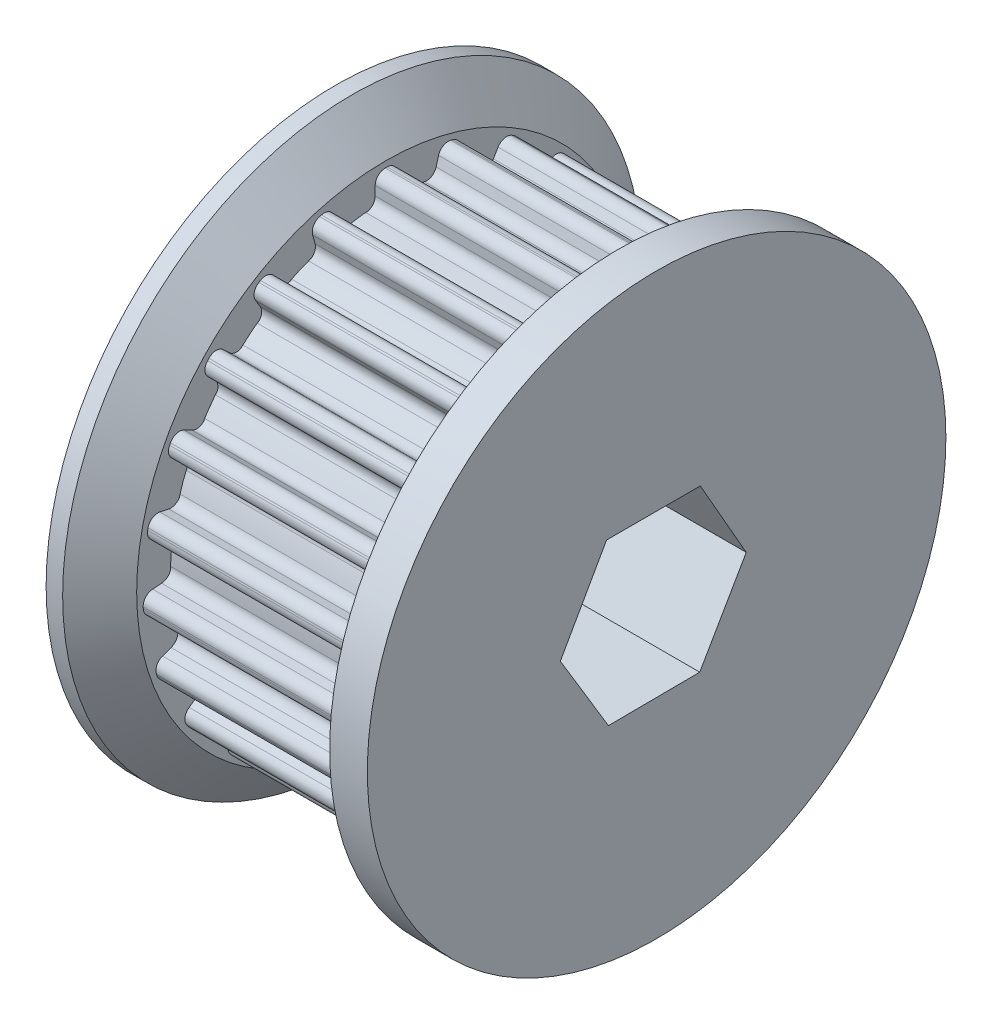
from build123d import *

# Parameters (mm, degrees)
SKETCH1_R               = 17.116
BOSS_EXTRUDE1_DEPTH     = 18.54
BOSS_EXTRUDE6_DEPTH     = 18.5
FILLET6_R               = 0.8
CIRPATTERN6_START       = 0.04
CIRPATTERN6_DEPTH       = 18.5
SKETCH10_R              = 23
BOSS_EXTRUDE7_DEPTH     = 3
BOSS_EXTRUDE8_START     = 4
SKETCH11_R              = 23
BOSS_EXTRUDE8_DEPTH     = 4
CHAMFER1_SIZE           = 3.2
CHAMFER1_SIZE2          = 2.68511882
CUT_EXTRUDE5_DEPTH      = 40.012454422
CUT_EXTRUDE5_DEPTH_BACK = 40.012454422


# Read off the part's stored shape, not the designer's step: CirPattern6
with BuildPart() as part:
    # Sketch1 → Boss-Extrude1 (new body)
    with BuildSketch(Plane(origin=(0, 0, 0), x_dir=(0, 0, -1), z_dir=(1, 0, 0))):
        Circle(SKETCH1_R)
    extrude(amount=BOSS_EXTRUDE1_DEPTH)

    # Sketch8 → Boss-Extrude6 (add)
    with BuildSketch(Plane(origin=(18.54, 0, 0), x_dir=(0, 0, -1), z_dir=(1, 0, 0))):
        Polygon((0, 19.36), (0.875, 19.36), (0.875, 17), (-0.875, 17), (-0.875, 19.36), align=None)
    extrude(amount=-BOSS_EXTRUDE6_DEPTH)

    # Fillet6
    fillet6_edges = [part.edges().sort_by_distance(p)[0] for p in [
        (9.29, 19.36, 0.875),
        (9.29, 17.093619599, -0.875),
        (9.29, 17.093619599, 0.875),
        (9.29, 19.36, -0.875),
    ]]
    fillet(fillet6_edges, radius=FILLET6_R)

    # CirPattern6 outline → CirPattern6 (add)
    with BuildSketch(Plane.YZ.offset(CIRPATTERN6_START)):
        with BuildLine():
            ThreePointArc((15.977374418, -6.138482117), (16.365129587, -5.710481094), (16.939992598, -5.655060282))
            Line((16.939992598, -5.655060282), (17.635672678, -5.849980699))
            ThreePointArc((17.635672678, -5.849980699), (18.243598269, -5.776975245), (18.621843925, -5.295484286))
            Line((18.621843925, -5.295484286), (18.662313441, -5.151046693))
            ThreePointArc((18.662313441, -5.151046693), (18.589307987, -4.543121102), (18.107817028, -4.164875446))
            Line((18.107817028, -4.164875446), (17.412136947, -3.969955029))
            ThreePointArc((17.412136947, -3.969955029), (16.9497586, -3.623912818), (16.840835522, -3.056749076))
            ThreePointArc((16.840835522, -3.056749076), (16.48129229, -4.617841535), (15.977374418, -6.138482117))
        make_face()
        with BuildLine():
            ThreePointArc((15.695366628, -8.520476655), (15.343495596, -8.062518443), (15.391630627, -7.486999576))
            ThreePointArc((15.391630627, -7.486999576), (14.624242528, -8.893198889), (13.728747379, -10.221494578))
            ThreePointArc((13.728747379, -10.221494578), (14.217596828, -9.913980086), (14.786094715, -10.015710613))
            Line((14.786094715, -10.015710613), (15.403388192, -10.391095092))
            ThreePointArc((15.403388192, -10.391095092), (16.008466889, -10.48481324), (16.502590876, -10.123226728))
            Line((16.502590876, -10.123226728), (16.580528468, -9.995063817))
            ThreePointArc((16.580528468, -9.995063817), (16.674246616, -9.389985121), (16.312660105, -8.895861134))
            Line((16.312660105, -8.895861134), (15.695366628, -8.520476655))
        make_face()
        with BuildLine():
            ThreePointArc((12.814542767, -12.439073505), (12.599275714, -11.903163958), (12.8008989, -11.361973568))
            ThreePointArc((12.8008989, -11.361973568), (11.682579599, -12.508988365), (10.461921951, -13.546425547))
            ThreePointArc((10.461921951, -13.546425547), (11.015609954, -13.38220453), (11.535579829, -13.633541506))
            Line((11.535579829, -13.633541506), (12.028704869, -14.161549497))
            ThreePointArc((12.028704869, -14.161549497), (12.586060752, -14.415040601), (13.159416155, -14.200175754))
            Line((13.159416155, -14.200175754), (13.26904155, -14.097792783))
            ThreePointArc((13.26904155, -14.097792783), (13.522532653, -13.5404369), (13.307667807, -12.967081497))
            Line((13.307667807, -12.967081497), (12.814542767, -12.439073505))
        make_face()
        with BuildLine():
            ThreePointArc((15.977374418, 6.138482117), (16.48129229, 4.617841535), (16.840835522, 3.056749076))
            ThreePointArc((16.840835522, 3.056749076), (16.9497586, 3.623912818), (17.412136947, 3.969955029))
            Line((17.412136947, 3.969955029), (18.107817028, 4.164875446))
            ThreePointArc((18.107817028, 4.164875446), (18.589307987, 4.543121102), (18.662313441, 5.151046693))
            Line((18.662313441, 5.151046693), (18.621843925, 5.295484286))
            ThreePointArc((18.621843925, 5.295484286), (18.243598269, 5.776975245), (17.635672678, 5.849980699))
            Line((17.635672678, 5.849980699), (16.939992598, 5.655060282))
            ThreePointArc((16.939992598, 5.655060282), (16.365129587, 5.710481094), (15.977374418, 6.138482117))
        make_face()
        with BuildLine():
            ThreePointArc((8.983322892, -15.435121179), (8.920625191, -14.861006256), (9.260783062, -14.394281958))
            ThreePointArc((9.260783062, -14.394281958), (7.874473186, -15.197043398), (6.419183632, -15.866680103))
            ThreePointArc((6.419183632, -15.866680103), (6.996645682, -15.857932082), (7.42952376, -16.240234995))
            Line((7.42952376, -16.240234995), (7.761907534, -16.881706562))
            ThreePointArc((7.761907534, -16.881706562), (8.230204068, -17.276170345), (8.840267739, -17.223962706))
            Line((8.840267739, -17.223962706), (8.973450522, -17.15495295))
            ThreePointArc((8.973450522, -17.15495295), (9.367914305, -16.686656416), (9.315706666, -16.076592746))
            Line((9.315706666, -16.076592746), (8.983322892, -15.435121179))
        make_face()
        with BuildLine():
            ThreePointArc((13.728747379, 10.221494578), (14.624242528, 8.893198889), (15.391630627, 7.486999576))
            ThreePointArc((15.391630627, 7.486999576), (15.343495596, 8.062518443), (15.695366628, 8.520476655))
            Line((15.695366628, 8.520476655), (16.312660105, 8.895861134))
            ThreePointArc((16.312660105, 8.895861134), (16.674246616, 9.389985121), (16.580528468, 9.995063817))
            Line((16.580528468, 9.995063817), (16.502590876, 10.123226728))
            ThreePointArc((16.502590876, 10.123226728), (16.008466889, 10.48481324), (15.403388192, 10.391095092))
            Line((15.403388192, 10.391095092), (14.786094715, 10.015710613))
            ThreePointArc((14.786094715, 10.015710613), (14.217596828, 9.913980086), (13.728747379, 10.221494578))
        make_face()
        with BuildLine():
            ThreePointArc((4.485851054, -17.286416526), (4.580372706, -16.716675704), (5.033837309, -16.359032305))
            ThreePointArc((5.033837309, -16.359032305), (3.482353119, -16.758003245), (1.900363829, -17.010175582))
            ThreePointArc((1.900363829, -17.010175582), (2.458772208, -17.157549358), (2.7724539, -17.642464549))
            Line((2.7724539, -17.642464549), (2.919445026, -18.349824679))
            ThreePointArc((2.919445026, -18.349824679), (3.263950799, -18.856005568), (3.865477106, -18.970327139))
            Line((3.865477106, -18.970327139), (4.012339719, -18.939808737))
            ThreePointArc((4.012339719, -18.939808737), (4.518520608, -18.595302963), (4.632842179, -17.993776656))
            Line((4.632842179, -17.993776656), (4.485851054, -17.286416526))
        make_face()
        with BuildLine():
            ThreePointArc((10.461921951, 13.546425547), (11.682579599, 12.508988365), (12.8008989, 11.361973568))
            ThreePointArc((12.8008989, 11.361973568), (12.599275714, 11.903163958), (12.814542767, 12.439073505))
            Line((12.814542767, 12.439073505), (13.307667807, 12.967081497))
            ThreePointArc((13.307667807, 12.967081497), (13.522532653, 13.5404369), (13.26904155, 14.097792783))
            Line((13.26904155, 14.097792783), (13.159416155, 14.200175754))
            ThreePointArc((13.159416155, 14.200175754), (12.586060752, 14.415040601), (12.028704869, 14.161549497))
            Line((12.028704869, 14.161549497), (11.535579829, 13.633541506))
            ThreePointArc((11.535579829, 13.633541506), (11.015609954, 13.38220453), (10.461921951, 13.546425547))
        make_face()
        with BuildLine():
            ThreePointArc((-0.344315836, -17.85565744), (-0.099585068, -17.332545789), (0.433554872, -17.110508063))
            ThreePointArc((0.433554872, -17.110508063), (-1.168037147, -17.076098653), (-2.759397265, -16.892104154))
            ThreePointArc((-2.759397265, -16.892104154), (-2.261457153, -17.184669688), (-2.090236182, -17.736233216))
            Line((-2.090236182, -17.736233216), (-2.139539365, -18.457020244))
            ThreePointArc((-2.139539365, -18.457020244), (-1.94437477, -19.037377118), (-1.39599828, -19.309749191))
            Line((-1.39599828, -19.309749191), (-1.246347965, -19.319985553))
            ThreePointArc((-1.246347965, -19.319985553), (-0.665991091, -19.124820957), (-0.393619019, -18.576444468))
            Line((-0.393619019, -18.576444468), (-0.344315836, -17.85565744))
        make_face()
        with BuildLine():
            ThreePointArc((6.419183632, 15.866680103), (7.874473186, 15.197043398), (9.260783062, 14.394281958))
            ThreePointArc((9.260783062, 14.394281958), (8.920625191, 14.861006256), (8.983322892, 15.435121179))
            Line((8.983322892, 15.435121179), (9.315706666, 16.076592746))
            ThreePointArc((9.315706666, 16.076592746), (9.367914305, 16.686656416), (8.973450522, 17.15495295))
            Line((8.973450522, 17.15495295), (8.840267739, 17.223962706))
            ThreePointArc((8.840267739, 17.223962706), (8.230204068, 17.276170345), (7.761907534, 16.881706562))
            Line((7.761907534, 16.881706562), (7.42952376, 16.240234995))
            ThreePointArc((7.42952376, 16.240234995), (6.996645682, 15.857932082), (6.419183632, 15.866680103))
        make_face()
        with BuildLine():
            ThreePointArc((-5.148946395, -17.100625925), (-4.772157074, -16.662940244), (-4.198882347, -16.592975714))
            ThreePointArc((-4.198882347, -16.592975714), (-5.731799442, -16.127737943), (-7.214506488, -15.521222636))
            ThreePointArc((-7.214506488, -15.521222636), (-6.813964582, -15.937281682), (-6.797903008, -16.514586604))
            Line((-6.797903008, -16.514586604), (-7.039843909, -17.195343054))
            ThreePointArc((-7.039843909, -17.195343054), (-7.008494957, -17.806833498), (-6.553938861, -18.217055481))
            Line((-6.553938861, -18.217055481), (-6.412599722, -18.267287423))
            ThreePointArc((-6.412599722, -18.267287423), (-5.801109278, -18.235938471), (-5.390887295, -17.781382375))
            Line((-5.390887295, -17.781382375), (-5.148946395, -17.100625925))
        make_face()
        with BuildLine():
            ThreePointArc((1.900363829, 17.010175582), (3.482353119, 16.758003245), (5.033837309, 16.359032305))
            ThreePointArc((5.033837309, 16.359032305), (4.580372706, 16.716675704), (4.485851054, 17.286416526))
            Line((4.485851054, 17.286416526), (4.632842179, 17.993776656))
            ThreePointArc((4.632842179, 17.993776656), (4.518520608, 18.595302963), (4.012339719, 18.939808737))
            Line((4.012339719, 18.939808737), (3.865477106, 18.970327139))
            ThreePointArc((3.865477106, 18.970327139), (3.263950799, 18.856005568), (2.919445026, 18.349824679))
            Line((2.919445026, 18.349824679), (2.7724539, 17.642464549))
            ThreePointArc((2.7724539, 17.642464549), (2.458772208, 17.157549358), (1.900363829, 17.010175582))
        make_face()
        with BuildLine():
            ThreePointArc((-9.571703154, -15.077319216), (-9.09080002, -14.75752065), (-8.519907671, -14.844818263))
            ThreePointArc((-8.519907671, -14.844818263), (-9.870460393, -13.983256689), (-11.134548769, -12.999203041))
            ThreePointArc((-11.134548769, -12.999203041), (-10.86111143, -13.507898401), (-11.001400467, -14.068128652))
            Line((-11.001400467, -14.068128652), (-11.418035435, -14.658365932))
            ThreePointArc((-11.418035435, -14.658365932), (-11.552827135, -15.255638498), (-11.225803778, -15.773286105))
            Line((-11.225803778, -15.773286105), (-11.103258294, -15.859788153))
            ThreePointArc((-11.103258294, -15.859788153), (-10.505985728, -15.994579853), (-9.988338122, -15.667556496))
            Line((-9.988338122, -15.667556496), (-9.571703154, -15.077319216))
        make_face()
        with BuildLine():
            ThreePointArc((-2.759397265, 16.892104154), (-1.168037147, 17.076098653), (0.433554872, 17.110508063))
            ThreePointArc((0.433554872, 17.110508063), (-0.099585068, 17.332545789), (-0.344315836, 17.85565744))
            Line((-0.344315836, 17.85565744), (-0.393619019, 18.576444468))
            ThreePointArc((-0.393619019, 18.576444468), (-0.665991091, 19.124820957), (-1.246347965, 19.319985553))
            Line((-1.246347965, 19.319985553), (-1.39599828, 19.309749191))
            ThreePointArc((-1.39599828, 19.309749191), (-1.94437477, 19.037377118), (-2.139539365, 18.457020244))
            Line((-2.139539365, 18.457020244), (-2.090236182, 17.736233216))
            ThreePointArc((-2.090236182, 17.736233216), (-2.261457153, 17.184669688), (-2.759397265, 16.892104154))
        make_face()
        with BuildLine():
            ThreePointArc((-13.284570479, -11.935796714), (-12.735219917, -11.757603259), (-12.209050419, -11.995688553))
            ThreePointArc((-12.209050419, -11.995688553), (-13.277074452, -10.801701255), (-14.228792505, -9.513092024))
            ThreePointArc((-14.228792505, -9.513092024), (-14.10273933, -10.076696091), (-14.388974381, -10.578301955))
            Line((-14.388974381, -10.578301955), (-14.949403507, -11.034244867))
            ThreePointArc((-14.949403507, -11.034244867), (-15.240338974, -11.57300258), (-15.065102184, -12.159684255))
            Line((-15.065102184, -12.159684255), (-14.970438992, -12.276040949))
            ThreePointArc((-14.970438992, -12.276040949), (-14.431681279, -12.566976417), (-13.844999604, -12.391739626))
            Line((-13.844999604, -12.391739626), (-13.284570479, -11.935796714))
        make_face()
        with BuildLine():
            ThreePointArc((-7.214506488, 15.521222636), (-5.731799442, 16.127737943), (-4.198882347, 16.592975714))
            ThreePointArc((-4.198882347, 16.592975714), (-4.772157074, 16.662940244), (-5.148946395, 17.100625925))
            Line((-5.148946395, 17.100625925), (-5.390887295, 17.781382375))
            ThreePointArc((-5.390887295, 17.781382375), (-5.801109278, 18.235938471), (-6.412599722, 18.267287423))
            Line((-6.412599722, 18.267287423), (-6.553938861, 18.217055481))
            ThreePointArc((-6.553938861, 18.217055481), (-7.008494957, 17.806833498), (-7.039843909, 17.195343054))
            Line((-7.039843909, 17.195343054), (-6.797903008, 16.514586604))
            ThreePointArc((-6.797903008, 16.514586604), (-6.813964582, 15.937281682), (-7.214506488, 15.521222636))
        make_face()
        with BuildLine():
            ThreePointArc((-16.012181983, -7.909050773), (-15.435126811, -7.885678223), (-14.99270375, -8.2568935))
            ThreePointArc((-14.99270375, -8.2568935), (-15.698988637, -6.819033054), (-16.267751793, -5.321438491))
            ThreePointArc((-16.267751793, -5.321438491), (-16.298431569, -5.89815133), (-16.709383891, -6.303930995))
            Line((-16.709383891, -6.303930995), (-17.37204271, -6.591764339))
            ThreePointArc((-17.37204271, -6.591764339), (-17.797544592, -7.032050005), (-17.787090879, -7.644254252))
            Line((-17.787090879, -7.644254252), (-17.727330715, -7.781835947))
            ThreePointArc((-17.727330715, -7.781835947), (-17.287045049, -8.20733783), (-16.674840802, -8.196884116))
            Line((-16.674840802, -8.196884116), (-16.012181983, -7.909050773))
        make_face()
        with BuildLine():
            ThreePointArc((-11.134548769, 12.999203041), (-9.870460393, 13.983256689), (-8.519907671, 14.844818263))
            ThreePointArc((-8.519907671, 14.844818263), (-9.09080002, 14.75752065), (-9.571703154, 15.077319216))
            Line((-9.571703154, 15.077319216), (-9.988338122, 15.667556496))
            ThreePointArc((-9.988338122, 15.667556496), (-10.505985728, 15.994579853), (-11.103258294, 15.859788153))
            Line((-11.103258294, 15.859788153), (-11.225803778, 15.773286105))
            ThreePointArc((-11.225803778, 15.773286105), (-11.552827135, 15.255638498), (-11.418035435, 14.658365932))
            Line((-11.418035435, 14.658365932), (-11.001400467, 14.068128652))
            ThreePointArc((-11.001400467, 14.068128652), (-10.86111143, 13.507898401), (-11.134548769, 12.999203041))
        make_face()
        with BuildLine():
            ThreePointArc((-17.552243201, -3.295726717), (-16.990280962, -3.428908507), (-16.664416831, -3.905722428))
            ThreePointArc((-16.664416831, -3.905722428), (-16.956580652, -2.330628366), (-17.10020635, -0.735118209))
            ThreePointArc((-17.10020635, -0.735118209), (-17.285343699, -1.282167667), (-17.790534837, -1.562026312))
            Line((-17.790534837, -1.562026312), (-18.506276976, -1.660402804))
            ThreePointArc((-18.506276976, -1.660402804), (-19.034787746, -1.96956245), (-19.189892414, -2.561884881))
            Line((-19.189892414, -2.561884881), (-19.169467417, -2.710487772))
            ThreePointArc((-19.169467417, -2.710487772), (-18.860307771, -3.238998542), (-18.26798534, -3.39410321))
            Line((-18.26798534, -3.39410321), (-17.552243201, -3.295726717))
        make_face()
        with BuildLine():
            ThreePointArc((-14.228792505, 9.513092024), (-13.277074452, 10.801701255), (-12.209050419, 11.995688553))
            ThreePointArc((-12.209050419, 11.995688553), (-12.735219917, 11.757603259), (-13.284570479, 11.935796714))
            Line((-13.284570479, 11.935796714), (-13.844999604, 12.391739626))
            ThreePointArc((-13.844999604, 12.391739626), (-14.431681279, 12.566976417), (-14.970438992, 12.276040949))
            Line((-14.970438992, 12.276040949), (-15.065102184, 12.159684255))
            ThreePointArc((-15.065102184, 12.159684255), (-15.240338974, 11.57300258), (-14.949403507, 11.034244867))
            Line((-14.949403507, 11.034244867), (-14.388974381, 10.578301955))
            ThreePointArc((-14.388974381, 10.578301955), (-14.10273933, 10.076696091), (-14.228792505, 9.513092024))
        make_face()
        with BuildLine():
            ThreePointArc((-17.790534837, 1.562026312), (-17.285343699, 1.282167667), (-17.10020635, 0.735118209))
            ThreePointArc((-17.10020635, 0.735118209), (-16.956580652, 2.330628366), (-16.664416831, 3.905722428))
            ThreePointArc((-16.664416831, 3.905722428), (-16.990280962, 3.428908507), (-17.552243201, 3.295726717))
            Line((-17.552243201, 3.295726717), (-18.26798534, 3.39410321))
            ThreePointArc((-18.26798534, 3.39410321), (-18.860307771, 3.238998542), (-19.169467417, 2.710487772))
            Line((-19.169467417, 2.710487772), (-19.189892414, 2.561884881))
            ThreePointArc((-19.189892414, 2.561884881), (-19.034787746, 1.96956245), (-18.506276976, 1.660402804))
            Line((-18.506276976, 1.660402804), (-17.790534837, 1.562026312))
        make_face()
        with BuildLine():
            ThreePointArc((-16.267751793, 5.321438491), (-15.698988637, 6.819033054), (-14.99270375, 8.2568935))
            ThreePointArc((-14.99270375, 8.2568935), (-15.435126811, 7.885678223), (-16.012181983, 7.909050773))
            Line((-16.012181983, 7.909050773), (-16.674840802, 8.196884116))
            ThreePointArc((-16.674840802, 8.196884116), (-17.287045049, 8.20733783), (-17.727330715, 7.781835947))
            Line((-17.727330715, 7.781835947), (-17.787090879, 7.644254252))
            ThreePointArc((-17.787090879, 7.644254252), (-17.797544592, 7.032050005), (-17.37204271, 6.591764339))
            Line((-17.37204271, 6.591764339), (-16.709383891, 6.303930995))
            ThreePointArc((-16.709383891, 6.303930995), (-16.298431569, 5.89815133), (-16.267751793, 5.321438491))
        make_face()
    extrude(amount=CIRPATTERN6_DEPTH)

    # Sketch10 → Boss-Extrude7 (add)
    with BuildSketch(Plane(origin=(18.54, 0, 0), x_dir=(0, 0, -1), z_dir=(1, 0, 0))):
        Circle(SKETCH10_R)
    extrude(amount=BOSS_EXTRUDE7_DEPTH)

    # Sketch11 → Boss-Extrude8 (add)
    with BuildSketch(Plane.ZY.offset(BOSS_EXTRUDE8_START)):
        with Locations(Location((0, 0, 0), (0, 0, 180))):
            Circle(SKETCH11_R)
    extrude(amount=-BOSS_EXTRUDE8_DEPTH)

    # Chamfer1
    chamfer1_edges = [part.edges().sort_by_distance(p)[0] for p in [
        (0, 0, 23),
    ]]
    chamfer1_side = [part.faces().sort_by_distance(p)[0] for p in [
        (0, 0, 22.349461761),
    ]]
    chamfer(chamfer1_edges, length=CHAMFER1_SIZE, length2=CHAMFER1_SIZE2, reference=chamfer1_side[0])

    # Sketch9 → Cut-Extrude5 (cut, two sides: drawn at the far end of the back side and taken through both)
    with BuildSketch(Plane.ZY.offset(-CUT_EXTRUDE5_DEPTH_BACK)):
        Polygon((-3.471061286, 6.444457654), (-7.125456531, 0.043657654), (-3.429837967, -6.357142346), (3.826782025, -6.409720657), (7.655941161, -0.063516257), (3.981752634, 6.444457654), align=None)
    extrude(amount=CUT_EXTRUDE5_DEPTH + CUT_EXTRUDE5_DEPTH_BACK, mode=Mode.SUBTRACT)


solid = part.part
